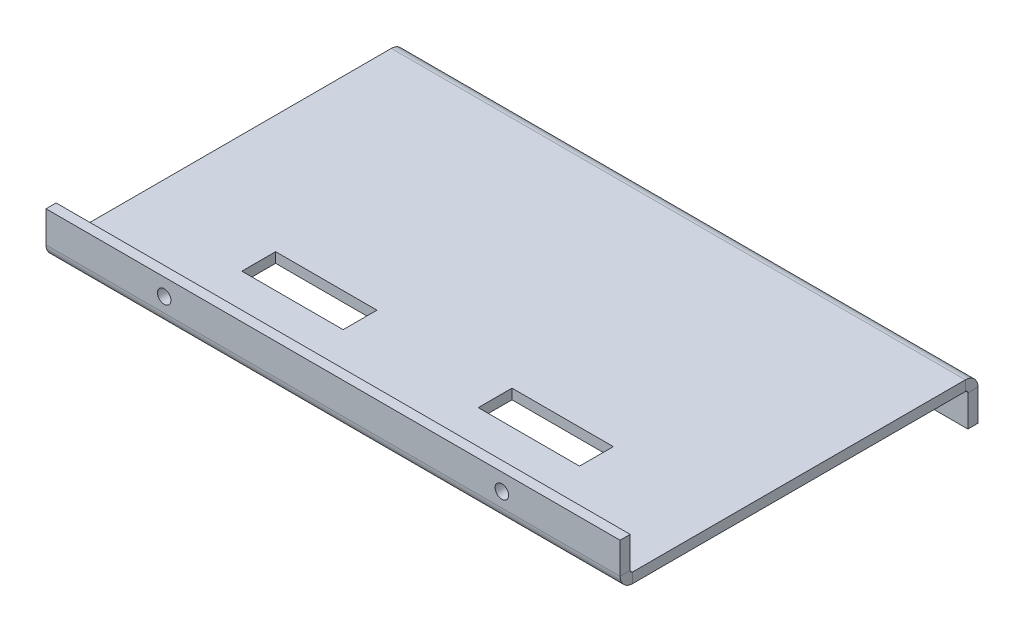
from build123d import *

# Parameters (mm, degrees)
SKETCH_1_W                       = 170
SKETCH_1_H                       = 100
SM_BASE_FLANGE_1_DEPTH           = 3
SM_EDGE_FLANGE_3_STRIP_W         = 13.4732
SM_EDGE_FLANGE_3_STRIP_H         = 3
SM_EDGE_FLANGE_3_STRIP_CUT_DEPTH = 170
SM_EDGE_FLANGE_3_DEPTH           = 170
SM_EDGE_FLANGE_4_STRIP_W         = 13.4732
SM_EDGE_FLANGE_4_STRIP_H         = 3
SM_EDGE_FLANGE_4_STRIP_CUT_DEPTH = 170
SM_EDGE_FLANGE_4_DEPTH           = 170
CUT_EXTRUDE_2_REACH              = 138.492
SKETCH_19_R                      = 2
CUT_EXTRUDE_3_REACH              = 138.492
SKETCH_20_R                      = 2
CUT_EXTRUDE_4_REACH              = 103.01
SKETCH_21_W                      = 30
SKETCH_21_H                      = 10


# Sheet-metal steps are written as plain solids
with BuildPart() as part:
    # Sketch 1 → 基体-法兰1 (new body)
    with BuildSketch(Plane(origin=(0, 0, 0), x_dir=(1, 0, 0), z_dir=(0, 1, 0))):
        Rectangle(SKETCH_1_W, SKETCH_1_H)
    extrude(amount=-SM_BASE_FLANGE_1_DEPTH)

    # 边线-法兰3 strip (across the edge) → 边线-法兰3 strip cut (cut)
    with BuildSketch(Plane(origin=(-85, 0, 50), x_dir=(0, 0, -1), z_dir=(1, 0, 0))):
        with Locations((-6, -1.5)):
            Rectangle(SM_EDGE_FLANGE_3_STRIP_W, SM_EDGE_FLANGE_3_STRIP_H)
    extrude(amount=SM_EDGE_FLANGE_3_STRIP_CUT_DEPTH, mode=Mode.SUBTRACT)

    # 边线-法兰3 section (across the edge) → 边线-法兰3 (add)
    with BuildSketch(Plane(origin=(-85, 0, 50), x_dir=(0, 0, -1), z_dir=(1, 0, 0))):
        with BuildLine():
            Line((-3, 0.7366), (-3, 10))
            Line((-3, 10), (0, 10))
            Line((0, 10), (0, 0.7366))
            ThreePointArc((0, 0.7366), (0.215745145, 0.215745145), (0.7366, 0))
            Line((0.7366, 0), (0.7366, -3))
            ThreePointArc((0.7366, -3), (-1.905575199, -1.905575199), (-3, 0.7366))
        make_face()
    extrude(amount=SM_EDGE_FLANGE_3_DEPTH)

    # 边线-法兰4 strip (across the edge) → 边线-法兰4 strip cut (cut)
    with BuildSketch(Plane(origin=(-85, -3, -50), x_dir=(0, 0, 1), z_dir=(1, 0, 0))):
        with Locations((-6, -1.5)):
            Rectangle(SM_EDGE_FLANGE_4_STRIP_W, SM_EDGE_FLANGE_4_STRIP_H)
    extrude(amount=SM_EDGE_FLANGE_4_STRIP_CUT_DEPTH, mode=Mode.SUBTRACT)

    # 边线-法兰4 section (across the edge) → 边线-法兰4 (add)
    with BuildSketch(Plane(origin=(-85, -3, -50), x_dir=(0, 0, 1), z_dir=(1, 0, 0))):
        with BuildLine():
            Line((-3, 0.7366), (-3, 10))
            Line((-3, 10), (0, 10))
            Line((0, 10), (0, 0.7366))
            ThreePointArc((0, 0.7366), (0.215745145, 0.215745145), (0.7366, 0))
            Line((0.7366, 0), (0.7366, -3))
            ThreePointArc((0.7366, -3), (-1.905575199, -1.905575199), (-3, 0.7366))
        make_face()
    extrude(amount=SM_EDGE_FLANGE_4_DEPTH)

    # 草图19 → 切除-拉伸2 (cut, up to next)
    with BuildSketch(Plane.XY.offset(53), mode=Mode.PRIVATE) as cut_extrude_2_sk1:
        with Locations((-50, 5)):
            Circle(SKETCH_19_R)
    cut_extrude_2_tool1 = extrude(cut_extrude_2_sk1.sketch, amount=-CUT_EXTRUDE_2_REACH, mode=Mode.PRIVATE) & part.part
    # 草图19 → 切除-拉伸2 (cut, up to next)
    with BuildSketch(Plane.XY.offset(53), mode=Mode.PRIVATE) as cut_extrude_2_sk2:
        with Locations((50, 5)):
            Circle(SKETCH_19_R)
    cut_extrude_2_tool2 = extrude(cut_extrude_2_sk2.sketch, amount=-CUT_EXTRUDE_2_REACH, mode=Mode.PRIVATE) & part.part
    add(cut_extrude_2_tool1.solids().sort_by_distance((-50, 5, 53))[0], mode=Mode.SUBTRACT)
    add(cut_extrude_2_tool2.solids().sort_by_distance((50, 5, 53))[0], mode=Mode.SUBTRACT)

    # 草图20 → 切除-拉伸3 (cut, up to next)
    with BuildSketch(Plane(origin=(0, 0, -53), x_dir=(-1, 0, 0), z_dir=(0, 0, -1)), mode=Mode.PRIVATE) as cut_extrude_3_sk1:
        with Locations(Location((-50, -8, 0), (0, 0, 90))):
            Circle(SKETCH_20_R)
    cut_extrude_3_tool1 = extrude(cut_extrude_3_sk1.sketch, amount=-CUT_EXTRUDE_3_REACH, mode=Mode.PRIVATE) & part.part
    # 草图20 → 切除-拉伸3 (cut, up to next)
    with BuildSketch(Plane(origin=(0, 0, -53), x_dir=(-1, 0, 0), z_dir=(0, 0, -1)), mode=Mode.PRIVATE) as cut_extrude_3_sk2:
        with Locations(Location((50, -8, 0), (0, 0, 90))):
            Circle(SKETCH_20_R)
    cut_extrude_3_tool2 = extrude(cut_extrude_3_sk2.sketch, amount=-CUT_EXTRUDE_3_REACH, mode=Mode.PRIVATE) & part.part
    add(cut_extrude_3_tool1.solids().sort_by_distance((50, -8, -53))[0], mode=Mode.SUBTRACT)
    add(cut_extrude_3_tool2.solids().sort_by_distance((-50, -8, -53))[0], mode=Mode.SUBTRACT)

    # 草图21 → 切除-拉伸4 (cut, up to next)
    with BuildSketch(Plane(origin=(0, 0, 0), x_dir=(1, 0, 0), z_dir=(0, 1, 0)), mode=Mode.PRIVATE) as cut_extrude_4_sk1:
        with Locations((-35, -25)):
            Rectangle(SKETCH_21_W, SKETCH_21_H)
    cut_extrude_4_tool1 = extrude(cut_extrude_4_sk1.sketch, amount=-CUT_EXTRUDE_4_REACH, mode=Mode.PRIVATE) & part.part
    # 草图21 → 切除-拉伸4 (cut, up to next)
    with BuildSketch(Plane(origin=(0, 0, 0), x_dir=(1, 0, 0), z_dir=(0, 1, 0)), mode=Mode.PRIVATE) as cut_extrude_4_sk2:
        with Locations((35, -25)):
            Rectangle(SKETCH_21_W, SKETCH_21_H)
    cut_extrude_4_tool2 = extrude(cut_extrude_4_sk2.sketch, amount=-CUT_EXTRUDE_4_REACH, mode=Mode.PRIVATE) & part.part
    add(cut_extrude_4_tool1.solids().sort_by_distance((-35, 0, 25))[0], mode=Mode.SUBTRACT)
    add(cut_extrude_4_tool2.solids().sort_by_distance((35, 0, 25))[0], mode=Mode.SUBTRACT)


solid = part.part
